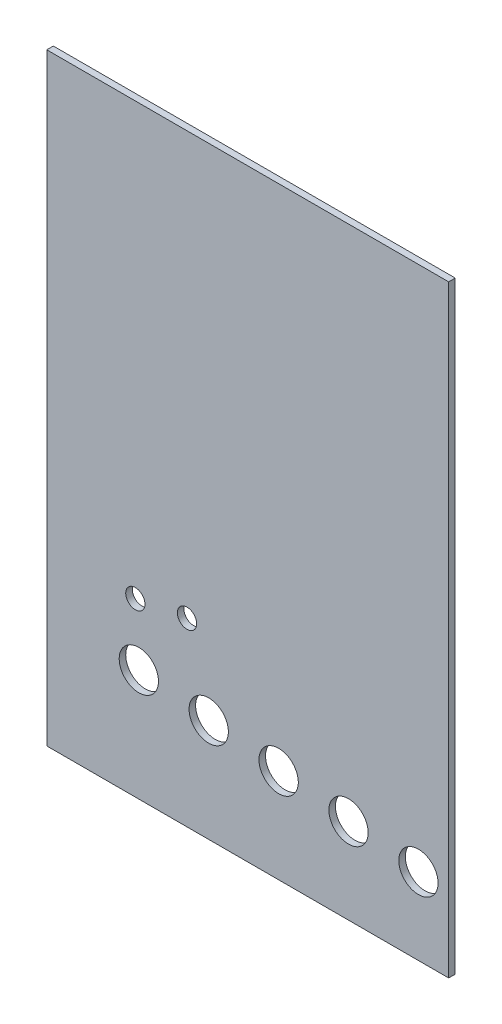
from build123d import *

# Parameters (mm, degrees)
SKETCH1_W           = 292.1
SKETCH1_H           = 438.15
SKETCH1_R           = 7
SKETCH1_R_2         = 14.2875
BOSS_EXTRUDE1_DEPTH = 4.7625


with BuildPart() as part:
    # Sketch1 → Boss-Extrude1 (new body)
    with BuildSketch(Plane.XY):
        with Locations((146.05, -219.075)):
            Rectangle(SKETCH1_W, SKETCH1_H)
        with Locations((101.925695163, -306.813385495)):
            Circle(SKETCH1_R, mode=Mode.SUBTRACT)
        with Locations((64.374426387, -313.256382727)):
            Circle(SKETCH1_R, mode=Mode.SUBTRACT)
        with Locations((66.914426387, -356.944382727)):
            Circle(SKETCH1_R_2, mode=Mode.SUBTRACT)
        with Locations((117.714426387, -363.294382727)):
            Circle(SKETCH1_R_2, mode=Mode.SUBTRACT)
        with Locations((168.514426387, -369.644382727)):
            Circle(SKETCH1_R_2, mode=Mode.SUBTRACT)
        with Locations((219.314426387, -375.994382727)):
            Circle(SKETCH1_R_2, mode=Mode.SUBTRACT)
        with Locations((270.114426387, -382.344382727)):
            Circle(SKETCH1_R_2, mode=Mode.SUBTRACT)
    extrude(amount=BOSS_EXTRUDE1_DEPTH)


solid = part.part
